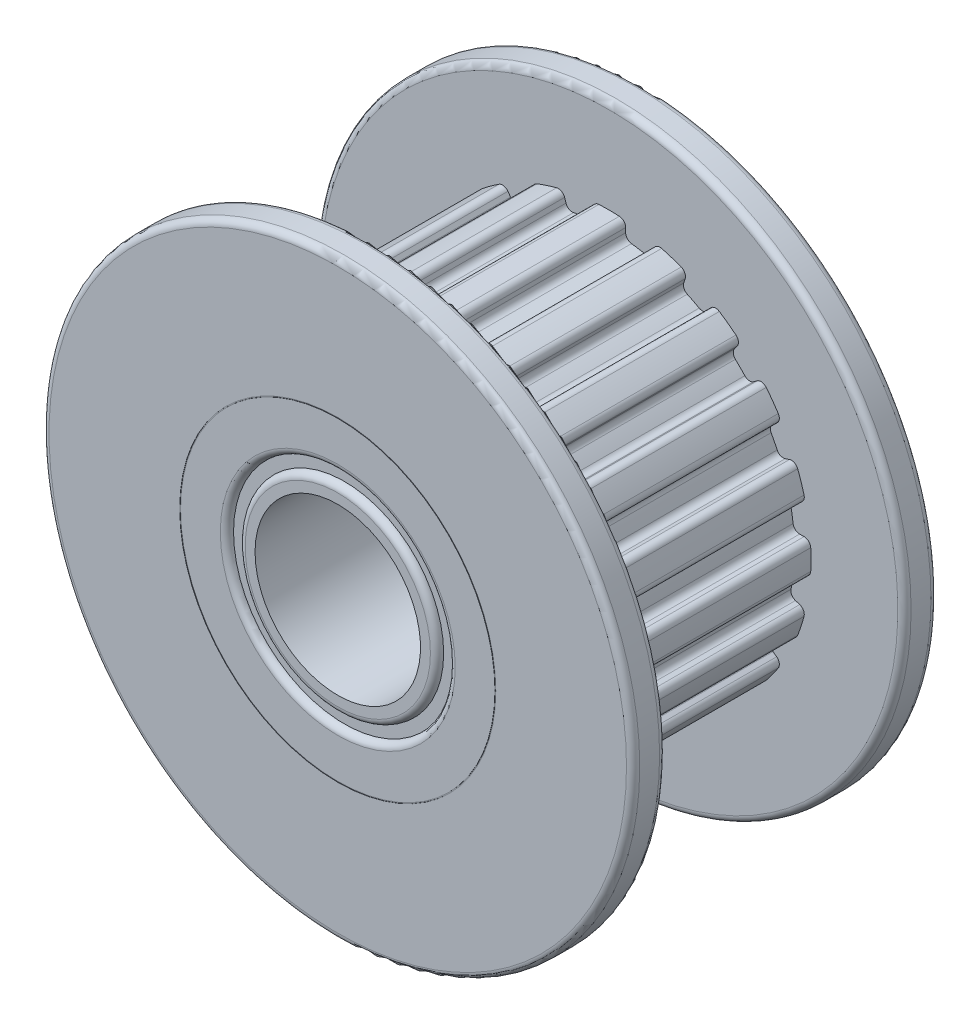
from build123d import *

# Parameters (mm, degrees)
P_IDAT_VYSUNUT_M1_DEPTH  = 7.2
ZAOBLIT1_R               = 0.2
SKICA2_R                 = 8.925
P_IDAT_VYSUNUT_M2_DEPTH  = 1
P_IDAT_START             = 1
SKICA3_R                 = 8.925
P_IDAT_VYSUNUT_M3_DEPTH  = 1
SKICA23_R                = 2.5
ODEBRAT_VYSUNUT_M4_DEPTH = 16.618938824
SKICA25_R                = 4.775
SKICA25_R_2              = 4.75
ODEBRAT_VYSUNUT_M6_DEPTH = 0.01
ODEBRAT_START            = -0.01
SKICA27_R                = 4.775
SKICA27_R_2              = 4.75
ODEBRAT_VYSUNUT_M7_DEPTH = 0.01
P_IDAT_START_2           = -9.2
SKICA28_R                = 3.5
SKICA28_R_2              = 2.5
P_IDAT_VYSUNUT_M4_DEPTH  = 9.2
SKICA29_R                = 3.35
SKICA29_R_2              = 3
ODEBRAT_VYSUNUT_M8_DEPTH = 0.2
ODEBRAT_START_2          = -0.2
SKICA30_R                = 3.35
SKICA30_R_2              = 3
ODEBRAT_VYSUNUT_M9_DEPTH = 0.2
ZAOBLIT2_R               = 0.2
ZAOBLIT3_R               = 0.2


with BuildPart() as part:
    # Skica1 → Přidat vysunutím1 (new body)
    with BuildSketch(Plane.XY):
        with BuildLine():
            Line((-0.5, 6.079473661), (-0.5, 5.577633907))
            ThreePointArc((-0.5, 5.577633907), (-0.876033004, 5.531054707), (-1.248055408, 5.45915357))
            Line((-1.248055408, 5.45915357), (-1.40313242, 5.936431539))
            ThreePointArc((-1.40313242, 5.936431539), (-1.885003666, 5.801444749), (-2.354188936, 5.627414544))
            Line((-2.354188936, 5.627414544), (-2.199111924, 5.150136576))
            ThreePointArc((-2.199111924, 5.150136576), (-2.542346799, 4.989636535), (-2.873942456, 4.806293245))
            Line((-2.873942456, 4.806293245), (-3.168916463, 5.212290135))
            ThreePointArc((-3.168916463, 5.212290135), (-3.585490039, 4.935003666), (-3.977933457, 4.624504883))
            Line((-3.977933457, 4.624504883), (-3.68295945, 4.218507993))
            ThreePointArc((-3.68295945, 4.218507993), (-3.959797975, 3.959797975), (-4.218507993, 3.68295945))
            Line((-4.218507993, 3.68295945), (-4.624504883, 3.977933457))
            ThreePointArc((-4.624504883, 3.977933457), (-4.935003666, 3.585490039), (-5.212290135, 3.168916463))
            Line((-5.212290135, 3.168916463), (-4.806293245, 2.873942456))
            ThreePointArc((-4.806293245, 2.873942456), (-4.989636535, 2.542346799), (-5.150136576, 2.199111924))
            Line((-5.150136576, 2.199111924), (-5.627414544, 2.354188936))
            ThreePointArc((-5.627414544, 2.354188936), (-5.801444749, 1.885003666), (-5.936431539, 1.40313242))
            Line((-5.936431539, 1.40313242), (-5.45915357, 1.248055408))
            ThreePointArc((-5.45915357, 1.248055408), (-5.531054707, 0.876033004), (-5.577633907, 0.5))
            Line((-5.577633907, 0.5), (-6.079473661, 0.5))
            ThreePointArc((-6.079473661, 0.5), (-6.1, 0), (-6.079473661, -0.5))
            Line((-6.079473661, -0.5), (-5.577633907, -0.5))
            ThreePointArc((-5.577633907, -0.5), (-5.531054707, -0.876033004), (-5.45915357, -1.248055408))
            Line((-5.45915357, -1.248055408), (-5.936431539, -1.40313242))
            ThreePointArc((-5.936431539, -1.40313242), (-5.801444749, -1.885003666), (-5.627414544, -2.354188936))
            Line((-5.627414544, -2.354188936), (-5.150136576, -2.199111924))
            ThreePointArc((-5.150136576, -2.199111924), (-4.989636535, -2.542346799), (-4.806293245, -2.873942456))
            Line((-4.806293245, -2.873942456), (-5.212290135, -3.168916463))
            ThreePointArc((-5.212290135, -3.168916463), (-4.935003666, -3.585490039), (-4.624504883, -3.977933457))
            Line((-4.624504883, -3.977933457), (-4.218507993, -3.68295945))
            ThreePointArc((-4.218507993, -3.68295945), (-3.959797975, -3.959797975), (-3.68295945, -4.218507993))
            Line((-3.68295945, -4.218507993), (-3.977933457, -4.624504883))
            ThreePointArc((-3.977933457, -4.624504883), (-3.585490039, -4.935003666), (-3.168916463, -5.212290135))
            Line((-3.168916463, -5.212290135), (-2.873942456, -4.806293245))
            ThreePointArc((-2.873942456, -4.806293245), (-2.542346799, -4.989636535), (-2.199111924, -5.150136576))
            Line((-2.199111924, -5.150136576), (-2.354188936, -5.627414544))
            ThreePointArc((-2.354188936, -5.627414544), (-1.885003666, -5.801444749), (-1.40313242, -5.936431539))
            Line((-1.40313242, -5.936431539), (-1.248055408, -5.45915357))
            ThreePointArc((-1.248055408, -5.45915357), (-0.876033004, -5.531054707), (-0.5, -5.577633907))
            Line((-0.5, -5.577633907), (-0.5, -6.079473661))
            ThreePointArc((-0.5, -6.079473661), (0, -6.1), (0.5, -6.079473661))
            Line((0.5, -6.079473661), (0.5, -5.577633907))
            ThreePointArc((0.5, -5.577633907), (0.876033004, -5.531054707), (1.248055408, -5.45915357))
            Line((1.248055408, -5.45915357), (1.40313242, -5.936431539))
            ThreePointArc((1.40313242, -5.936431539), (1.885003666, -5.801444749), (2.354188936, -5.627414544))
            Line((2.354188936, -5.627414544), (2.199111924, -5.150136576))
            ThreePointArc((2.199111924, -5.150136576), (2.542346799, -4.989636535), (2.873942456, -4.806293245))
            Line((2.873942456, -4.806293245), (3.168916463, -5.212290135))
            ThreePointArc((3.168916463, -5.212290135), (3.585490039, -4.935003666), (3.977933457, -4.624504883))
            Line((3.977933457, -4.624504883), (3.68295945, -4.218507993))
            ThreePointArc((3.68295945, -4.218507993), (3.959797975, -3.959797975), (4.218507993, -3.68295945))
            Line((4.218507993, -3.68295945), (4.624504883, -3.977933457))
            ThreePointArc((4.624504883, -3.977933457), (4.935003666, -3.585490039), (5.212290135, -3.168916463))
            Line((5.212290135, -3.168916463), (4.806293245, -2.873942456))
            ThreePointArc((4.806293245, -2.873942456), (4.989636535, -2.542346799), (5.150136576, -2.199111924))
            Line((5.150136576, -2.199111924), (5.627414544, -2.354188936))
            ThreePointArc((5.627414544, -2.354188936), (5.801444749, -1.885003666), (5.936431539, -1.40313242))
            Line((5.936431539, -1.40313242), (5.45915357, -1.248055408))
            ThreePointArc((5.45915357, -1.248055408), (5.531054707, -0.876033004), (5.577633907, -0.5))
            Line((5.577633907, -0.5), (6.079473661, -0.5))
            ThreePointArc((6.079473661, -0.5), (6.1, 0), (6.079473661, 0.5))
            Line((6.079473661, 0.5), (5.577633907, 0.5))
            ThreePointArc((5.577633907, 0.5), (5.531054707, 0.876033004), (5.45915357, 1.248055408))
            Line((5.45915357, 1.248055408), (5.936431539, 1.40313242))
            ThreePointArc((5.936431539, 1.40313242), (5.801444749, 1.885003666), (5.627414544, 2.354188936))
            Line((5.627414544, 2.354188936), (5.150136576, 2.199111924))
            ThreePointArc((5.150136576, 2.199111924), (4.989636535, 2.542346799), (4.806293245, 2.873942456))
            Line((4.806293245, 2.873942456), (5.212290135, 3.168916463))
            ThreePointArc((5.212290135, 3.168916463), (4.935003666, 3.585490039), (4.624504883, 3.977933457))
            Line((4.624504883, 3.977933457), (4.218507993, 3.68295945))
            ThreePointArc((4.218507993, 3.68295945), (3.959797975, 3.959797975), (3.68295945, 4.218507993))
            Line((3.68295945, 4.218507993), (3.977933457, 4.624504883))
            ThreePointArc((3.977933457, 4.624504883), (3.585490039, 4.935003666), (3.168916463, 5.212290135))
            Line((3.168916463, 5.212290135), (2.873942456, 4.806293245))
            ThreePointArc((2.873942456, 4.806293245), (2.542346799, 4.989636535), (2.199111924, 5.150136576))
            Line((2.199111924, 5.150136576), (2.354188936, 5.627414544))
            ThreePointArc((2.354188936, 5.627414544), (1.885003666, 5.801444749), (1.40313242, 5.936431539))
            Line((1.40313242, 5.936431539), (1.248055408, 5.45915357))
            ThreePointArc((1.248055408, 5.45915357), (0.876033004, 5.531054707), (0.5, 5.577633907))
            Line((0.5, 5.577633907), (0.5, 6.079473661))
            ThreePointArc((0.5, 6.079473661), (0, 6.1), (-0.5, 6.079473661))
        make_face()
    extrude(amount=P_IDAT_VYSUNUT_M1_DEPTH)

    # Zaoblit1
    zaoblit1_edges = [part.edges().sort_by_distance(p)[0] for p in [
        (0.5, 6.079473661, 3.6),
        (0.5, 5.577633907, 3.6),
        (1.248055408, 5.45915357, 3.6),
        (1.40313242, 5.936431539, 3.6),
        (2.354188936, 5.627414544, 3.6),
        (2.199111924, 5.150136576, 3.6),
        (2.873942456, 4.806293245, 3.6),
        (3.168916463, 5.212290135, 3.6),
        (3.977933457, 4.624504883, 3.6),
        (3.68295945, 4.218507993, 3.6),
        (4.218507993, 3.68295945, 3.6),
        (4.624504883, 3.977933457, 3.6),
        (5.212290135, 3.168916463, 3.6),
        (4.806293245, 2.873942456, 3.6),
        (5.150136576, 2.199111924, 3.6),
        (5.627414544, 2.354188936, 3.6),
        (5.936431539, 1.40313242, 3.6),
        (5.45915357, 1.248055408, 3.6),
        (5.577633907, 0.5, 3.6),
        (6.079473661, 0.5, 3.6),
        (6.079473661, -0.5, 3.6),
        (5.577633907, -0.5, 3.6),
        (5.45915357, -1.248055408, 3.6),
        (5.936431539, -1.40313242, 3.6),
        (5.627414544, -2.354188936, 3.6),
        (5.150136576, -2.199111924, 3.6),
        (4.806293245, -2.873942456, 3.6),
        (5.212290135, -3.168916463, 3.6),
        (4.624504883, -3.977933457, 3.6),
        (4.218507993, -3.68295945, 3.6),
        (3.68295945, -4.218507993, 3.6),
        (3.977933457, -4.624504883, 3.6),
        (3.168916463, -5.212290135, 3.6),
        (2.873942456, -4.806293245, 3.6),
        (2.199111924, -5.150136576, 3.6),
        (2.354188936, -5.627414544, 3.6),
        (1.40313242, -5.936431539, 3.6),
        (1.248055408, -5.45915357, 3.6),
        (0.5, -5.577633907, 3.6),
        (0.5, -6.079473661, 3.6),
        (-0.5, -6.079473661, 3.6),
        (-0.5, -5.577633907, 3.6),
        (-1.248055408, -5.45915357, 3.6),
        (-1.40313242, -5.936431539, 3.6),
        (-2.354188936, -5.627414544, 3.6),
        (-2.199111924, -5.150136576, 3.6),
        (-2.873942456, -4.806293245, 3.6),
        (-3.168916463, -5.212290135, 3.6),
        (-3.977933457, -4.624504883, 3.6),
        (-3.68295945, -4.218507993, 3.6),
        (-4.218507993, -3.68295945, 3.6),
        (-4.624504883, -3.977933457, 3.6),
        (-5.212290135, -3.168916463, 3.6),
        (-4.806293245, -2.873942456, 3.6),
        (-5.150136576, -2.199111924, 3.6),
        (-5.627414544, -2.354188936, 3.6),
        (-5.936431539, -1.40313242, 3.6),
        (-5.45915357, -1.248055408, 3.6),
        (-5.577633907, -0.5, 3.6),
        (-6.079473661, -0.5, 3.6),
        (-6.079473661, 0.5, 3.6),
        (-5.577633907, 0.5, 3.6),
        (-5.45915357, 1.248055408, 3.6),
        (-5.936431539, 1.40313242, 3.6),
        (-5.627414544, 2.354188936, 3.6),
        (-5.150136576, 2.199111924, 3.6),
        (-4.806293245, 2.873942456, 3.6),
        (-5.212290135, 3.168916463, 3.6),
        (-4.624504883, 3.977933457, 3.6),
        (-4.218507993, 3.68295945, 3.6),
        (-3.68295945, 4.218507993, 3.6),
        (-3.977933457, 4.624504883, 3.6),
        (-3.168916463, 5.212290135, 3.6),
        (-2.873942456, 4.806293245, 3.6),
        (-2.199111924, 5.150136576, 3.6),
        (-2.354188936, 5.627414544, 3.6),
        (-1.40313242, 5.936431539, 3.6),
        (-1.248055408, 5.45915357, 3.6),
        (-0.5, 5.577633907, 3.6),
        (-0.5, 6.079473661, 3.6),
    ]]
    fillet(zaoblit1_edges, radius=ZAOBLIT1_R)

    # Skica2 → Přidat vysunutím2 (add)
    with BuildSketch(Plane.XY.offset(7.2)):
        Circle(SKICA2_R)
    extrude(amount=P_IDAT_VYSUNUT_M2_DEPTH)

    # Skica3 → Přidat vysunutím3 (add)
    with BuildSketch(Plane(origin=(0, 0, 0), x_dir=(-1, 0, 0), z_dir=(0, 0, -1)).offset(P_IDAT_START)):
        with Locations(Location((0, 0, 0), (0, 0, 180))):
            Circle(SKICA3_R)
    extrude(amount=-P_IDAT_VYSUNUT_M3_DEPTH)

    # Skica23 → Odebrat vysunutím4 (cut, through all)
    with BuildSketch(Plane(origin=(0, 0, -1), x_dir=(-1, 0, 0), z_dir=(0, 0, -1))):
        Circle(SKICA23_R)
    extrude(amount=-ODEBRAT_VYSUNUT_M4_DEPTH, mode=Mode.SUBTRACT)

    # Skica25 → Odebrat vysunutím6 (cut)
    with BuildSketch(Plane.XY.offset(8.2)):
        Circle(SKICA25_R)
        Circle(SKICA25_R_2, mode=Mode.SUBTRACT)
    extrude(amount=-ODEBRAT_VYSUNUT_M6_DEPTH, mode=Mode.SUBTRACT)

    # Skica27 → Odebrat vysunutím7 (cut)
    with BuildSketch(Plane(origin=(0, 0, -1), x_dir=(-1, 0, 0), z_dir=(0, 0, -1)).offset(ODEBRAT_START)):
        with Locations(Location((0, 0, 0), (0, 0, 180))):
            Circle(SKICA27_R)
        with Locations(Location((0, 0, 0), (0, 0, 180))):
            Circle(SKICA27_R_2, mode=Mode.SUBTRACT)
    extrude(amount=ODEBRAT_VYSUNUT_M7_DEPTH, mode=Mode.SUBTRACT)

    # Skica28 → Přidat vysunutím4 (add)
    with BuildSketch(Plane.XY.offset(8.2).offset(P_IDAT_START_2)):
        Circle(SKICA28_R)
        with Locations(Location((0, 0, 0), (0, 0, 180))):
            Circle(SKICA28_R_2, mode=Mode.SUBTRACT)
    extrude(amount=P_IDAT_VYSUNUT_M4_DEPTH)

    # Skica29 → Odebrat vysunutím8 (cut)
    with BuildSketch(Plane.XY.offset(8.2)):
        Circle(SKICA29_R)
        Circle(SKICA29_R_2, mode=Mode.SUBTRACT)
    extrude(amount=-ODEBRAT_VYSUNUT_M8_DEPTH, mode=Mode.SUBTRACT)

    # Skica30 → Odebrat vysunutím9 (cut)
    with BuildSketch(Plane(origin=(0, 0, -1), x_dir=(-1, 0, 0), z_dir=(0, 0, -1)).offset(ODEBRAT_START_2)):
        with Locations(Location((0, 0, 0), (0, 0, 180))):
            Circle(SKICA30_R)
        with Locations(Location((0, 0, 0), (0, 0, 180))):
            Circle(SKICA30_R_2, mode=Mode.SUBTRACT)
    extrude(amount=ODEBRAT_VYSUNUT_M9_DEPTH, mode=Mode.SUBTRACT)

    # Zaoblit2
    zaoblit2_edges = [part.edges().sort_by_distance(p)[0] for p in [
        (-3.35, 0, 8.2),
        (-3, 0, 8.2),
        (-3.35, 0, -1),
        (-3, 0, -1),
    ]]
    fillet(zaoblit2_edges, radius=ZAOBLIT2_R - 0.0001)  # a hair under: the kernel refuses the full size

    # Zaoblit3
    zaoblit3_edges = [part.edges().sort_by_distance(p)[0] for p in [
        (-8.925, 0, 7.2),
        (-8.925, 0, 8.2),
        (-8.925, 0, 0),
        (-8.925, 0, -1),
    ]]
    fillet(zaoblit3_edges, radius=ZAOBLIT3_R)


solid = part.part
